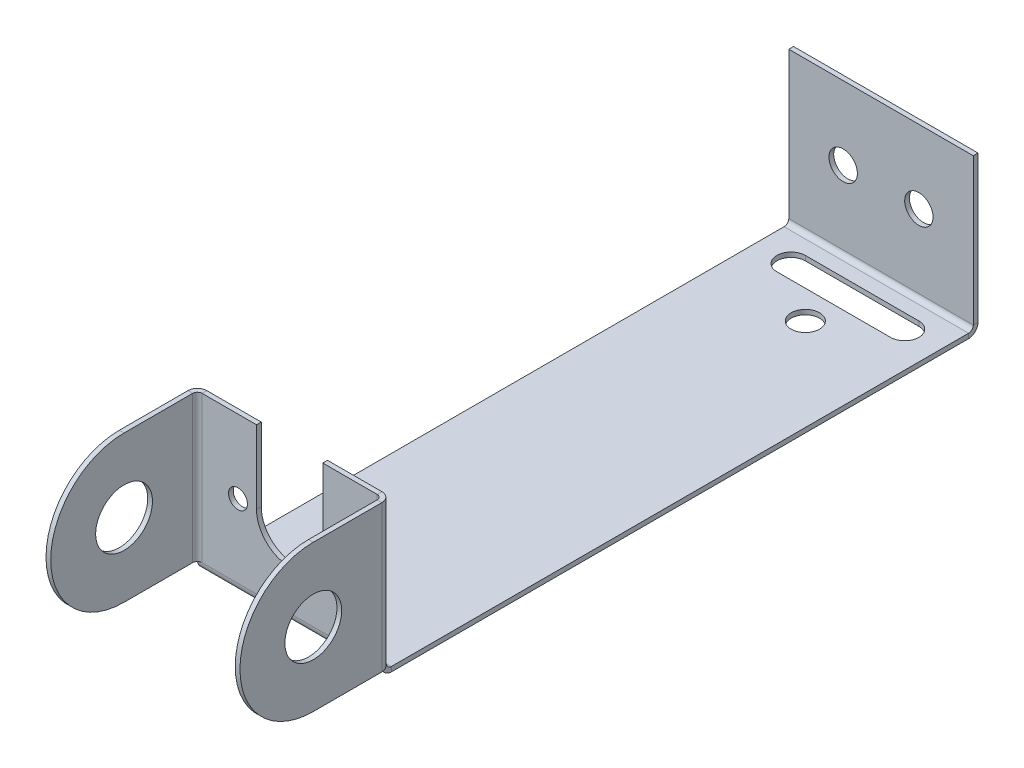
from build123d import *

# Parameters (mm, degrees)
BRIDA_BASE1_DEPTH                  = 19.5
BRIDA_DE_ARISTA1_STRIP_W           = 3
BRIDA_DE_ARISTA1_STRIP_H           = 0.5
BRIDA_DE_ARISTA1_STRIP_CUT_DEPTH   = 15.5
BRIDA_DE_ARISTA1_STRIP_2_W         = 3
BRIDA_DE_ARISTA1_STRIP_2_H         = 0.5
BRIDA_DE_ARISTA1_STRIP_CUT_2_DEPTH = 15.5
BRIDA_DE_ARISTA1_DEPTH             = 15.5
BRIDA_DE_ARISTA1_BEND_DEPTH        = 15.5
CROQUIS11_R                        = 3
CORTAR_EXTRUIR1_DEPTH              = 57.369658542
CROQUIS14_R                        = 1
CORTAR_EXTRUIR2_DEPTH              = 10
CROQUIS15_R                        = 1.5
CORTAR_EXTRUIR3_DEPTH              = 10
CROQUIS16_R                        = 1.5
CORTAR_EXTRUIR4_DEPTH              = 0.5


# Sheet-metal steps are written as plain solids
with BuildPart() as part:
    # Croquis1 → Brida base1 (new body)
    with BuildSketch(Plane(origin=(0, 0, 0), x_dir=(0, 0, -1), z_dir=(1, 0, 0))):
        with BuildLine():
            Line((-35.363451777, 5.587428088), (-35.363451777, -9.912571912))
            ThreePointArc((-35.363451777, -9.912571912), (-35.217005167, -10.266125303), (-34.863451777, -10.412571912))
            Line((-34.863451777, -10.412571912), (26.136548223, -10.412571912))
            ThreePointArc((26.136548223, -10.412571912), (26.490101614, -10.266125303), (26.636548223, -9.912571912))
            Line((26.636548223, -9.912571912), (26.636548223, 5.587428088))
            Line((26.636548223, 5.587428088), (27.136548223, 5.587428088))
            Line((27.136548223, 5.587428088), (27.136548223, -9.912571912))
            ThreePointArc((27.136548223, -9.912571912), (26.843655005, -10.619678693), (26.136548223, -10.912571912))
            Line((26.136548223, -10.912571912), (-34.863451777, -10.912571912))
            ThreePointArc((-34.863451777, -10.912571912), (-35.570558558, -10.619678693), (-35.863451777, -9.912571912))
            Line((-35.863451777, -9.912571912), (-35.863451777, 5.587428088))
            Line((-35.863451777, 5.587428088), (-35.363451777, 5.587428088))
        make_face()
    extrude(amount=BRIDA_BASE1_DEPTH)

    # Brida de arista1 strip (across the edge) → Brida de arista1 strip cut (cut)
    with BuildSketch(Plane(origin=(19.5, -9.912571912, 35.863451777), x_dir=(-1, 0, 0), z_dir=(0, 1, 0))):
        with Locations((-1, -0.25)):
            Rectangle(BRIDA_DE_ARISTA1_STRIP_W, BRIDA_DE_ARISTA1_STRIP_H)
    extrude(amount=BRIDA_DE_ARISTA1_STRIP_CUT_DEPTH, mode=Mode.SUBTRACT)

    # Brida de arista1 strip 2 (across the edge) → Brida de arista1 strip cut 2 (cut)
    with BuildSketch(Plane(origin=(0, 5.587428088, 35.863451777), x_dir=(1, 0, 0), z_dir=(0, -1, 0))):
        with Locations((-1, -0.25)):
            Rectangle(BRIDA_DE_ARISTA1_STRIP_2_W, BRIDA_DE_ARISTA1_STRIP_2_H)
    extrude(amount=BRIDA_DE_ARISTA1_STRIP_CUT_2_DEPTH, mode=Mode.SUBTRACT)

    # Brida de arista1 section (across the edge) → Brida de arista1 (add)
    with BuildSketch(Plane(origin=(19.5, -9.912571912, 35.863451777), x_dir=(-1, 0, 0), z_dir=(0, 1, 0))):
        with BuildLine():
            Line((-0.5, 0.5), (-0.5, 15.5))
            Line((-0.5, 15.5), (0, 15.5))
            Line((0, 15.5), (0, 0.5))
            ThreePointArc((0, 0.5), (0.146446609, 0.146446609), (0.5, 0))
            Line((0.5, 0), (0.5, -0.5))
            ThreePointArc((0.5, -0.5), (-0.207106781, -0.207106781), (-0.5, 0.5))
        make_face()
    extrude(amount=BRIDA_DE_ARISTA1_DEPTH)

    # Brida de arista1 section 2 (across the edge) → Brida de arista1 bend (add)
    with BuildSketch(Plane(origin=(0, 5.587428088, 35.863451777), x_dir=(1, 0, 0), z_dir=(0, -1, 0))):
        with BuildLine():
            Line((-0.5, 0.5), (-0.5, 15.5))
            Line((-0.5, 15.5), (0, 15.5))
            Line((0, 15.5), (0, 0.5))
            ThreePointArc((0, 0.5), (0.146446609, 0.146446609), (0.5, 0))
            Line((0.5, 0), (0.5, -0.5))
            ThreePointArc((0.5, -0.5), (-0.207106781, -0.207106781), (-0.5, 0.5))
        make_face()
    extrude(amount=BRIDA_DE_ARISTA1_BEND_DEPTH)

    # Croquis11 → Cortar-Extruir1 (cut, through all)
    with BuildSketch(Plane(origin=(20, 0, 0), x_dir=(0, 0, -1), z_dir=(1, 0, 0))):
        with Locations(Location((-43.613451777, -2.162571912, 0), (0, 0, 180))):
            Circle(CROQUIS11_R)
        with BuildLine():
            ThreePointArc((-43.613451777, -9.912571912), (-49.093529331, -7.642649466), (-51.363451777, -2.162571912))
            Line((-51.363451777, -2.162571912), (-51.363451777, -9.912571912))
            Line((-51.363451777, -9.912571912), (-43.613451777, -9.912571912))
        make_face()
        with BuildLine():
            ThreePointArc((-51.363451777, -2.162571912), (-49.093529331, 3.317505642), (-43.613451777, 5.587428088))
            Line((-43.613451777, 5.587428088), (-51.363451777, 5.587428088))
            Line((-51.363451777, 5.587428088), (-51.363451777, -2.162571912))
        make_face()
    extrude(amount=-CORTAR_EXTRUIR1_DEPTH, mode=Mode.SUBTRACT)

    # Croquis14 → Cortar-Extruir2 (cut)
    with BuildSketch(Plane.XY.offset(35.863451777)):
        with Locations((15.21, -2.162571912)):
            Circle(CROQUIS14_R)
        with Locations((4.29, -2.162571912)):
            Circle(CROQUIS14_R)
        with BuildLine():
            Line((6.25, 5.587428088), (6.25, -2.162571912))
            ThreePointArc((6.25, -2.162571912), (9.75, -5.662571912), (13.25, -2.162571912))
            Line((13.25, -2.162571912), (13.25, 5.587428088))
            Line((13.25, 5.587428088), (6.25, 5.587428088))
        make_face()
    extrude(amount=-CORTAR_EXTRUIR2_DEPTH, mode=Mode.SUBTRACT)

    # Croquis15 → Cortar-Extruir3 (cut)
    with BuildSketch(Plane(origin=(0, 0, -27.136548223), x_dir=(-1, 0, 0), z_dir=(0, 0, -1))):
        with Locations((-13.75, -2.162571912)):
            Circle(CROQUIS15_R)
        with Locations(Location((-5.75, -2.162571912, 0), (0, 0, 180))):
            Circle(CROQUIS15_R)
    extrude(amount=-CORTAR_EXTRUIR3_DEPTH, mode=Mode.SUBTRACT)

    # Croquis16 → Cortar-Extruir4 (cut)
    with BuildSketch(Plane(origin=(0, -10.412571912, 0), x_dir=(-1, 0, 0), z_dir=(0, 1, 0))):
        with Locations(Location((-9.75, -18.636548223, 0), (0, 0, 90))):
            Circle(CROQUIS16_R)
        with BuildLine():
            Line((-3.747619635, -21.636548223), (-15.752380365, -21.636548223))
            ThreePointArc((-15.752380365, -21.636548223), (-17.252380365, -23.136548223), (-15.752380365, -24.636548223))
            Line((-15.752380365, -24.636548223), (-3.747619635, -24.636548223))
            ThreePointArc((-3.747619635, -24.636548223), (-2.247619635, -23.136548223), (-3.747619635, -21.636548223))
        make_face()
    extrude(amount=-CORTAR_EXTRUIR4_DEPTH, mode=Mode.SUBTRACT)


solid = part.part
